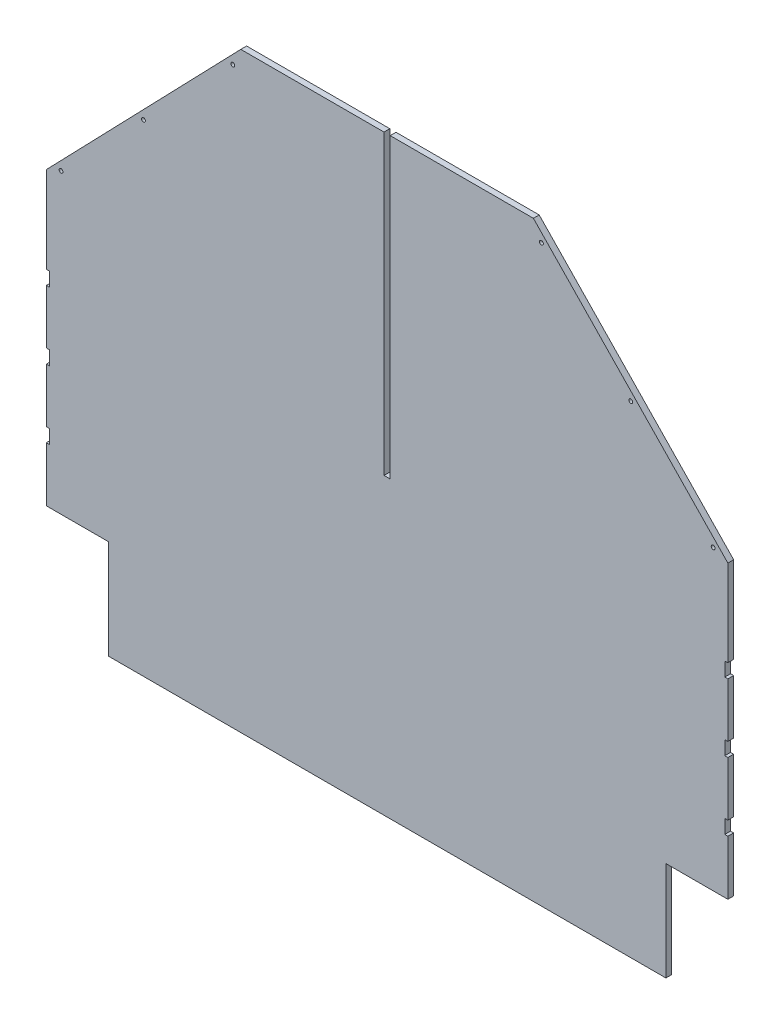
from build123d import *

# Parameters (mm, degrees)
BOSS_EXTRUDE1_DEPTH            = 11.90625
SKETCH2_W                      = 12.7
SKETCH2_H                      = 609.6
CUT_EXTRUDE1_DEPTH             = 1293.569468915
SKETCH3_W                      = 6.35
SKETCH3_H                      = 28.575
CUT_EXTRUDE3_DEPTH             = 1293.569468915
F_5_16_0_3125_DIAMETER_HOLE1_D = 7.9375


with BuildPart() as part:
    # Sketch1 → Boss-Extrude1 (new body)
    with BuildSketch(Plane.XY):
        Polygon((1068.467396061, -524.104266958), (941.467396061, -524.104266958), (941.467396061, -727.304266958), (-201.532603939, -727.304266958), (-201.532603939, -524.104266958), (-328.532603939, -524.104266958), (-328.532603939, 72.795733042), (70.055437863, 485.545733042), (669.87935426, 485.545733042), (1068.467396061, 72.795733042), align=None)
    extrude(amount=BOSS_EXTRUDE1_DEPTH)

    # Sketch2 → Cut-Extrude1 (cut, through all)
    with BuildSketch(Plane.XY.offset(11.90625)):
        with Locations((369.967396061, 180.745733042)):
            Rectangle(SKETCH2_W, SKETCH2_H)
    extrude(amount=-CUT_EXTRUDE1_DEPTH, mode=Mode.SUBTRACT)

    # Sketch3 → Cut-Extrude3 (cut, through all)
    with BuildSketch(Plane.XY.offset(11.90625)):
        with Locations((-325.357603939, -397.866266958)):
            Rectangle(SKETCH3_W, SKETCH3_H)
        with Locations((-325.357603939, -258.166266958)):
            Rectangle(SKETCH3_W, SKETCH3_H)
        with Locations((-325.357603939, -118.466266958)):
            Rectangle(SKETCH3_W, SKETCH3_H)
        with Locations((1065.292396061, -118.466266958)):
            Rectangle(SKETCH3_W, SKETCH3_H)
        with Locations((1065.292396061, -258.166266958)):
            Rectangle(SKETCH3_W, SKETCH3_H)
        with Locations((1065.292396061, -397.866266958)):
            Rectangle(SKETCH3_W, SKETCH3_H)
    extrude(amount=-CUT_EXTRUDE3_DEPTH, mode=Mode.SUBTRACT)

    # 5/16 (0.3125) Diameter Hole1 (through all)
    with Locations(Plane.XY.offset(11.90625)):
        with Locations((686.223731878, 450.338266504), (1038.342771546, 85.708326866), (869.339473897, 260.716364712), (-298.407979423, 85.708326866), (-129.404681774, 260.716364712), (53.711060244, 450.338266504)):
            Hole(F_5_16_0_3125_DIAMETER_HOLE1_D / 2)


solid = part.part
